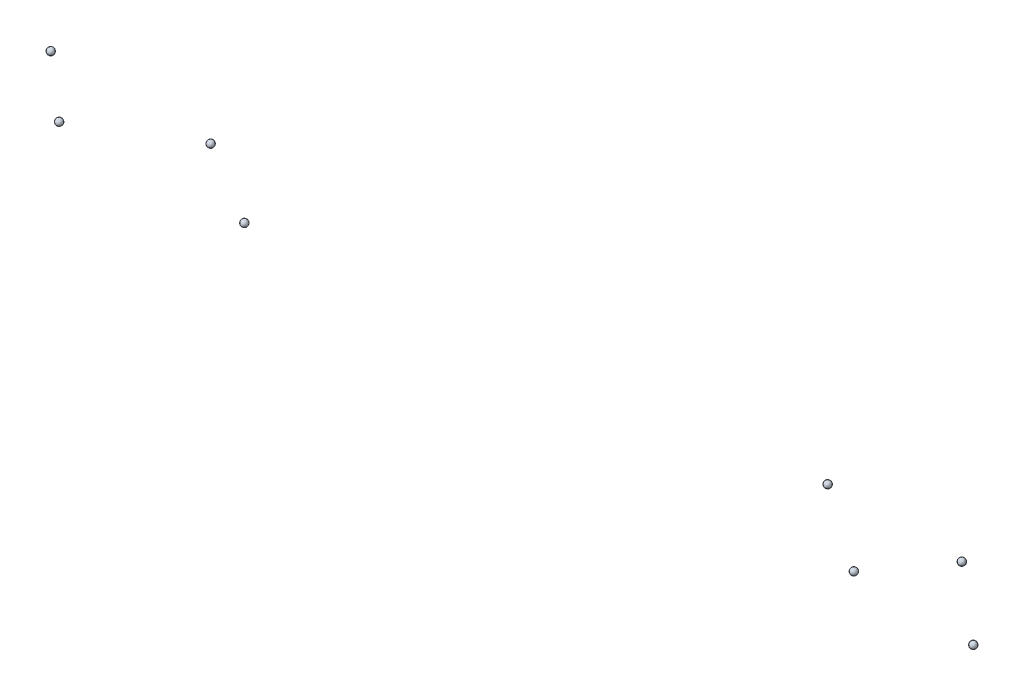
from build123d import *


with BuildPart() as part:
    # Sketch1 → Revolve1 (revolve)
    with BuildSketch(Plane(origin=(0, 0, 0), x_dir=(1, 0, 0), z_dir=(0, 1, 0))):
        with BuildLine():
            Line((127, 6.35), (127, 0))
            Line((127, 0), (127, -6.35))
            ThreePointArc((127, -6.35), (133.35, 0), (127, 6.35))
        make_face()
    revolve(axis=Axis((127, 0, -6.35), (0, 0, 1)))


with BuildPart() as body_2:
    # Sketch1<3> → Revolve2 (revolve)
    with BuildSketch(Plane(origin=(0, 0, 0), x_dir=(1, 0, 0), z_dir=(0, 1, 0))):
        with BuildLine():
            Line((-127, -6.35), (-127, 0))
            Line((-127, 0), (-127, 6.35))
            ThreePointArc((-127, 6.35), (-133.35, 0), (-127, -6.35))
        make_face()
    revolve(axis=Axis((-127, 0, -6.35), (0, 0, 1)))


with BuildPart() as body_3:
    # Sketch6 → Revolve3 (revolve)
    with BuildSketch(Plane.XY.offset(-34.29)):
        with BuildLine():
            Line((-111.76, -152.4), (-111.76, -158.75))
            ThreePointArc((-111.76, -158.75), (-105.41, -152.4), (-111.76, -146.05))
            Line((-111.76, -146.05), (-111.76, -152.4))
        make_face()
    revolve(axis=Axis((-111.76, -158.75, -34.29), (0, 1, 0)))


with BuildPart() as body_4:
    # Sketch4 → Revolve4 (revolve)
    with BuildSketch(Plane.XY.offset(-36.322)):
        with BuildLine():
            Line((112.3696, -161.925), (112.3696, -155.575))
            ThreePointArc((112.3696, -155.575), (106.0196, -161.925), (112.3696, -168.275))
            Line((112.3696, -168.275), (112.3696, -161.925))
        make_face()
    revolve(axis=Axis((112.3696, -155.575, -36.322), (0, -1, 0)))


with BuildPart() as body_5:
    # Sketch14 → Revolve5 (revolve)
    with BuildSketch(Plane(origin=(0, -225.425, 0), x_dir=(1, 0, 0), z_dir=(0, 1, 0))):
        with BuildLine():
            ThreePointArc((-1333.5, 95.25), (-1327.15, 101.6), (-1333.5, 107.95))
            Line((-1333.5, 107.95), (-1333.5, 101.6))
            Line((-1333.5, 101.6), (-1333.5, 95.25))
        make_face()
    revolve(axis=Axis((-1333.5, -225.425, -107.95), (0, 0, 1)))


with BuildPart() as body_6:
    # Sketch13 → Revolve6 (revolve)
    with BuildSketch(Plane.XY.offset(-92.075)):
        with BuildLine():
            Line((-1674.8125, -225.425), (-1674.8125, -219.075))
            ThreePointArc((-1674.8125, -219.075), (-1681.1625, -225.425), (-1674.8125, -231.775))
            Line((-1674.8125, -231.775), (-1674.8125, -225.425))
        make_face()
    revolve(axis=Axis((-1674.8125, -219.075, -92.075), (0, -1, 0)))


with BuildPart() as body_7:
    # Sketch10 → Revolve7 (revolve)
    with BuildSketch(Plane(origin=(-1358.9, 0, 0), x_dir=(0, 0, -1), z_dir=(1, 0, 0))):
        with BuildLine():
            ThreePointArc((63.155340242, -95.25), (69.505340242, -88.9), (63.155340242, -82.55))
            Line((63.155340242, -82.55), (63.155340242, -88.9))
            Line((63.155340242, -88.9), (63.155340242, -95.25))
        make_face()
    revolve(axis=Axis((-1358.9, -82.55, -63.155340242), (0, -1, 0)))


with BuildPart() as body_8:
    # Sketch11 → Revolve8 (revolve)
    with BuildSketch(Plane.XY.offset(-63.5)):
        with BuildLine():
            Line((-1662.1125, -95.25), (-1662.1125, -88.9))
            Line((-1662.1125, -88.9), (-1662.1125, -82.55))
            ThreePointArc((-1662.1125, -82.55), (-1668.4625, -88.9), (-1662.1125, -95.25))
        make_face()
    revolve(axis=Axis((-1662.1125, -95.25, -63.5), (0, 1, 0)))


solid = Compound([part.part, body_2.part, body_3.part, body_4.part, body_5.part, body_6.part, body_7.part, body_8.part])
